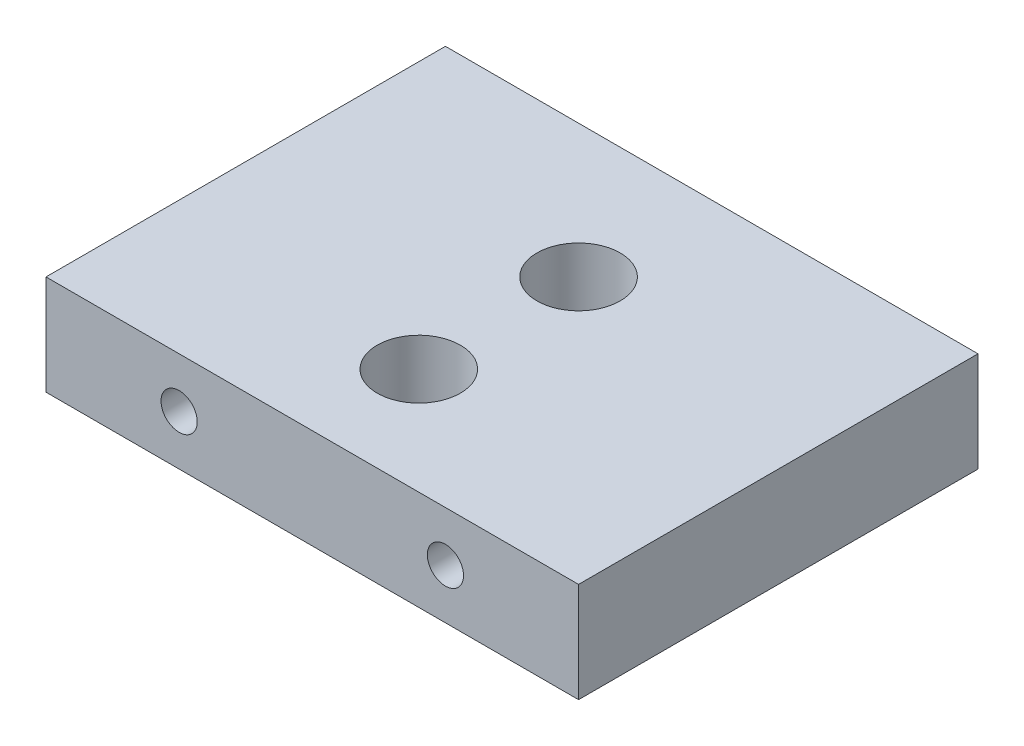
from build123d import *

# Parameters (mm, degrees)
SKETCH1_W                      = 50.8
SKETCH1_H                      = 9.525
BOSS_EXTRUDE1_DEPTH            = 38.1
F_5_16_0_3125_DIAMETER_HOLE1_D = 7.9375
F_8_36_TAPPED_HOLE1_D          = 3.4544


with BuildPart() as part:
    # Sketch1 → Boss-Extrude1 (new body)
    with BuildSketch(Plane.XY):
        Rectangle(SKETCH1_W, SKETCH1_H)
    extrude(amount=BOSS_EXTRUDE1_DEPTH)

    # 5/16 (0.3125) Diameter Hole1 (through all)
    with Locations(Plane(origin=(0, -4.7625, 0), x_dir=(-1, 0, 0), z_dir=(0, -1, 0))):
        with Locations((0, -12.7), (0, -27.94)):
            Hole(F_5_16_0_3125_DIAMETER_HOLE1_D / 2)

    # #8-36 Tapped Hole1 (through all)
    with Locations(Plane(origin=(0, 0, 0), x_dir=(-1, 0, 0), z_dir=(0, 0, -1))):
        with Locations((-12.7, 0), (12.7, 0)):
            Hole(F_8_36_TAPPED_HOLE1_D / 2)


solid = part.part
